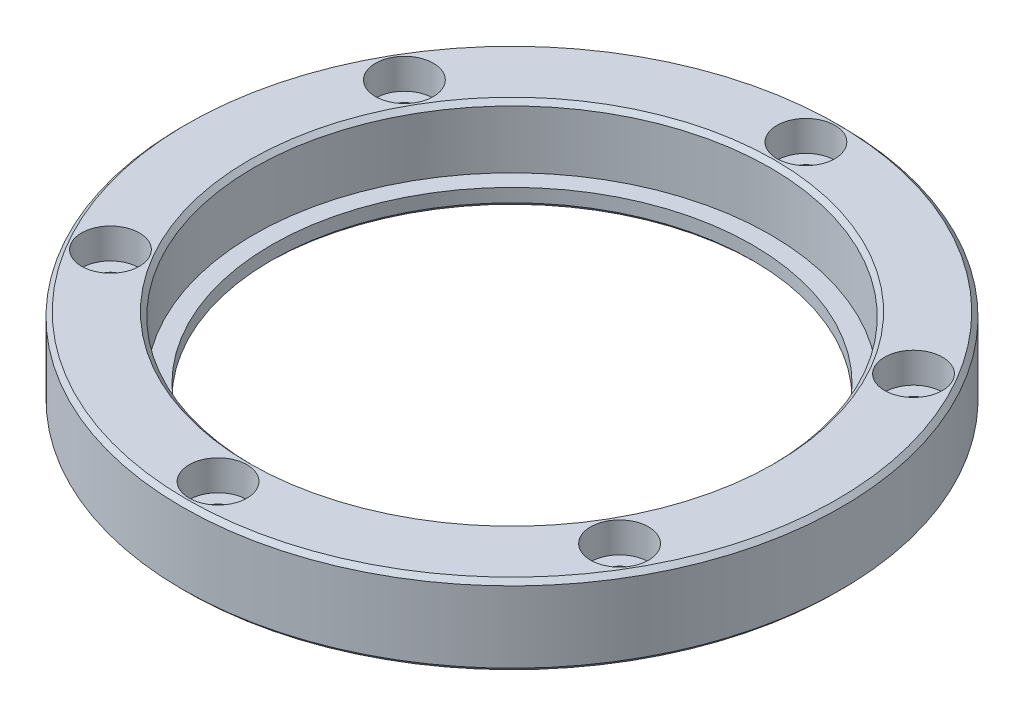
from build123d import *

# Parameters (mm, degrees)
CBORE_FOR_M3_HEX_SOCKET_HEAD_CAP_SCREW1_D           = 3.4
CBORE_FOR_M3_HEX_SOCKET_HEAD_CAP_SCREW1_CBORE_D     = 6.5
CBORE_FOR_M3_HEX_SOCKET_HEAD_CAP_SCREW1_CBORE_DEPTH = 3.4
F_0_5MM_CHAMFER1_SIZE                               = 0.5


with BuildPart() as part:
    # Sketch1 → Revolve1 (revolve)
    with BuildSketch(Plane.XY):
        Polygon((27, 0), (37, 0), (37, 9), (29, 9), (29, 2), (27, 2), align=None)
    revolve(axis=Axis((0, 0, 0), (0, 1, 0)))

    # CBORE for M3 Hex Socket Head Cap Screw1 (through all)
    with Locations(Plane(origin=(0, 9, 0), x_dir=(1, 0, 0), z_dir=(0, 1, 0))):
        with Locations((28.578838325, -16.5), (0, -33), (-28.578838325, -16.5), (-28.578838325, 16.5), (0, 33), (28.578838325, 16.5)):
            CounterBoreHole(CBORE_FOR_M3_HEX_SOCKET_HEAD_CAP_SCREW1_D / 2, CBORE_FOR_M3_HEX_SOCKET_HEAD_CAP_SCREW1_CBORE_D / 2, CBORE_FOR_M3_HEX_SOCKET_HEAD_CAP_SCREW1_CBORE_DEPTH)

    # 0,5mm Chamfer1
    f_0_5mm_chamfer1_edges = [part.edges().sort_by_distance(p)[0] for p in [
        (-27, 0, 0),
        (-37, 0, 0),
        (-37, 9, 0),
        (-29, 9, 0),
    ]]
    chamfer(f_0_5mm_chamfer1_edges, length=F_0_5MM_CHAMFER1_SIZE)


solid = part.part
